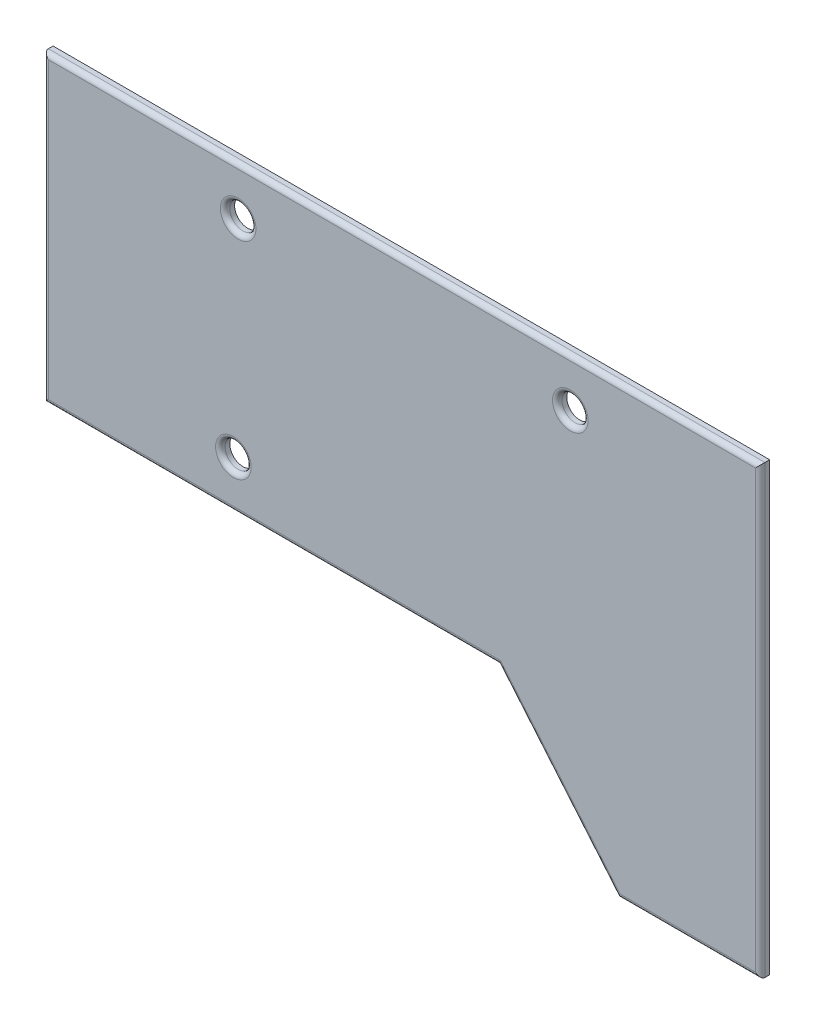
from build123d import *

# Parameters (mm, degrees)
SKETCH1_R           = 2.75
BOSS_EXTRUDE1_DEPTH = 2
FILLET1_R           = 1


with BuildPart() as part:
    # Sketch1 → Boss-Extrude1 (new body)
    with BuildSketch(Plane.XY):
        Polygon((0, 0), (0, 64), (151, 64), (151, -30), (121, -30), (95.827011065, 0), align=None)
        with Locations((41, 54)):
            Circle(SKETCH1_R, mode=Mode.SUBTRACT)
        with Locations((111, 54)):
            Circle(SKETCH1_R, mode=Mode.SUBTRACT)
        with Locations((40, 10)):
            Circle(SKETCH1_R, mode=Mode.SUBTRACT)
    extrude(amount=BOSS_EXTRUDE1_DEPTH)

    # Fillet1
    fillet1_edges = [part.edges().sort_by_distance(p)[0] for p in [
        (37.25, 10, 2),
        (108.25, 54, 2),
        (38.25, 54, 2),
        (0, 32, 2),
        (75.5, 64, 2),
        (151, 17, 2),
        (136, -30, 2),
        (108.413505532, -15, 2),
        (47.913505532, 0, 2),
    ]]
    fillet(fillet1_edges, radius=FILLET1_R)


solid = part.part
